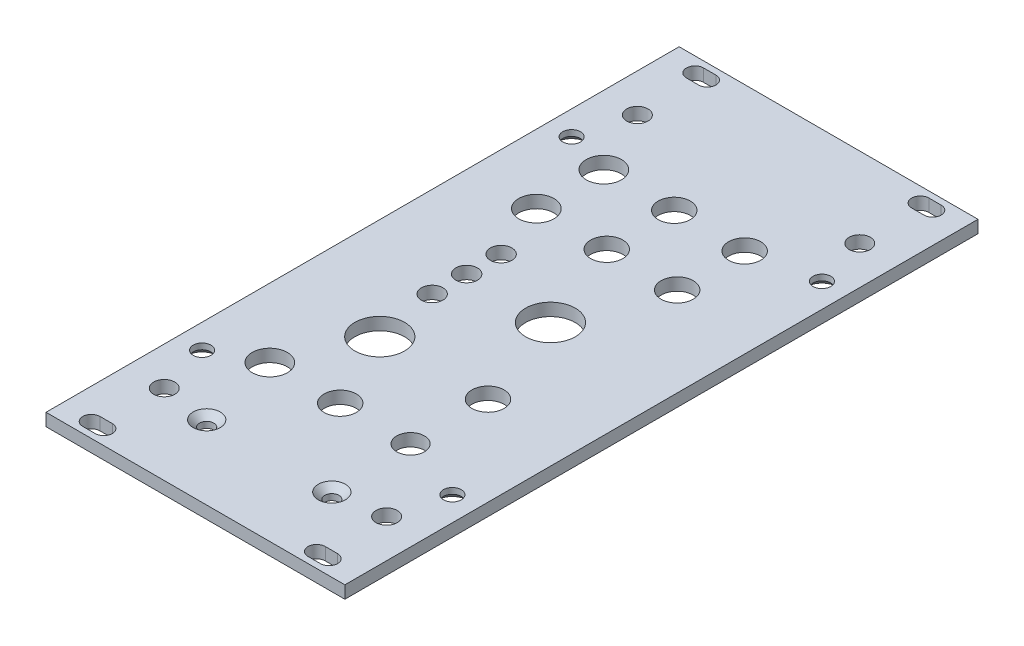
from build123d import *

# Parameters (mm, degrees)
SKETCH1_W                                      = 60.6552
SKETCH1_H                                      = 128.4986
BOSS_EXTRUDE1_DEPTH                            = 2.54
CSK_FOR_M3_FLAT_HEAD_MACHINE_SCREW1_AT_2_COUNT = 2
CSK_FOR_M3_FLAT_HEAD_MACHINE_SCREW1_AT_2_PITCH = 75.0062
M3_CLEARANCE_SLOT1_DEPTH                       = 2.54
F_1_4_CLEARANCE_HOLE1_D                        = 7.14248
F_1_4_CLEARANCE_HOLE2_D                        = 6.5278
F_3_8_CLEARANCE_HOLE2_D                        = 10.0838
F_10_CLEARANCE_HOLE1_D                         = 5.6134
CSK_FOR_M2_5_FLAT_HEAD_MACHINE_SCREW1_AT_COUNT = 2
CSK_FOR_M2_5_FLAT_HEAD_MACHINE_SCREW1_AT_PITCH = 25.4
F_11_64_0_17188_DIAMETER_HOLE1_D               = 4.365752
F_6_CLEARANCE_HOLE1_D                          = 4.3053


# Read off the part's stored shape, not the designer's step: M3 Clearance Slot1
with BuildPart() as part:
    # Sketch1 → Boss-Extrude1 (new body)
    with BuildSketch(Plane(origin=(0, 0, 0), x_dir=(1, 0, 0), z_dir=(0, 1, 0))):
        Rectangle(SKETCH1_W, SKETCH1_H)
    extrude(amount=BOSS_EXTRUDE1_DEPTH)

    # Sketch5 → CSK for M3 Flat Head Machine Screw1 (revolve, cut)
    with BuildSketch(Plane(origin=(25.4, 0, -37.5031), x_dir=(0, 0, -1), z_dir=(1, 0, 0))):
        Polygon((0, 0), (0, 2.54), (1.8, 2.54), (1.8, 1.35), (3.15, 0), align=None)
    csk_for_m3_flat_head_machine_screw1 = revolve(axis=Axis((25.4, -6.35, -37.5031), (0, 1, 0)), mode=Mode.SUBTRACT)

    # CSK for M3 Flat Head Machine Screw1 at 2: CSK for M3 Flat Head Machine Screw1 ×2
    with Locations(*[(0, 0, i * CSK_FOR_M3_FLAT_HEAD_MACHINE_SCREW1_AT_2_PITCH) for i in range(1, CSK_FOR_M3_FLAT_HEAD_MACHINE_SCREW1_AT_2_COUNT)]):
        add(csk_for_m3_flat_head_machine_screw1, mode=Mode.SUBTRACT)

    # M3 Clearance Slot1 outline → M3 Clearance Slot1 (cut)
    with BuildSketch(Plane(origin=(0, 0, 0), x_dir=(1, 0, 0), z_dir=(0, 1, 0))):
        with BuildLine():
            ThreePointArc((24.11, -63.0021), (25.86, -61.2521), (24.11, -59.5021))
            Line((24.11, -59.5021), (21.61, -59.5021))
            ThreePointArc((21.61, -59.5021), (19.86, -61.2521), (21.61, -63.0021))
            Line((21.61, -63.0021), (24.11, -63.0021))
        make_face()
        with BuildLine():
            ThreePointArc((24.11, 59.5021), (25.86, 61.2521), (24.11, 63.0021))
            Line((24.11, 63.0021), (21.61, 63.0021))
            ThreePointArc((21.61, 63.0021), (19.86, 61.2521), (21.61, 59.5021))
            Line((21.61, 59.5021), (24.11, 59.5021))
        make_face()
    m3_clearance_slot1 = extrude(amount=M3_CLEARANCE_SLOT1_DEPTH, mode=Mode.SUBTRACT)

    # Mirror1: CSK for M3 Flat Head Machine Screw1, M3 Clearance Slot1 across plane
    add(csk_for_m3_flat_head_machine_screw1.mirror(Plane(origin=(0, 0, 0), x_dir=(0, 0, 1), z_dir=(1, 0, 0))), mode=Mode.SUBTRACT)
    add(m3_clearance_slot1.mirror(Plane(origin=(0, 0, 0), x_dir=(0, 0, 1), z_dir=(1, 0, 0))), mode=Mode.SUBTRACT)

    # Mirror1 copy 1 sketch → Mirror1 copy 1 (revolve, cut)
    with BuildSketch(Plane(origin=(-25.4, 0, 37.5031), x_dir=(0, 0, -1), z_dir=(-1, 0, 0))):
        Polygon((0, 0), (0, -2.54), (1.8, -2.54), (1.8, -1.35), (3.15, 0), align=None)
    revolve(axis=Axis((-25.4, -6.35, 37.5031), (0, -1, 0)), mode=Mode.SUBTRACT)

    # 1/4 Clearance Hole1 (through all)
    with Locations(Plane(origin=(0, 0, 0), x_dir=(-1, 0, 0), z_dir=(0, -1, 0))):
        with Locations((16.3576, 35.0012), (16.3576, 21.301199968), (16.3576, -32.798800036)):
            Hole(F_1_4_CLEARANCE_HOLE1_D / 2)

    # 1/4 Clearance Hole2 (through all)
    with Locations(Plane(origin=(0, 0, 0), x_dir=(-1, 0, 0), z_dir=(0, -1, 0))):
        with Locations((-12.2174, 35.0012), (2.0701, 35.0012), (2.0701, 21.301199968), (-12.2174, 21.301199968), (-12.2174, -17.08879996), (2.0701, -32.798800036)):
            Hole(F_1_4_CLEARANCE_HOLE2_D / 2)

    # 3/8 Clearance Hole2 (through all)
    with Locations(Plane(origin=(0, 0, 0), x_dir=(-1, 0, 0), z_dir=(0, -1, 0))):
        with Locations((9.7536, -17.08879996), (-5.07365, 2.731200024)):
            Hole(F_3_8_CLEARANCE_HOLE2_D / 2)

    # #10 Clearance Hole1 (through all)
    with Locations(Plane(origin=(0, 0, 0), x_dir=(-1, 0, 0), z_dir=(0, -1, 0))):
        with Locations((-12.2174, -32.798800036)):
            Hole(F_10_CLEARANCE_HOLE1_D / 2)

    # Sketch73 → CSK for M2.5 Flat Head Machine Screw1 (revolve, cut)
    with BuildSketch(Plane(origin=(-12.7, 2.54, 49.2633), x_dir=(0, 0, 1), z_dir=(1, 0, 0))):
        Polygon((0, 0), (0, 2.54), (1.45, 2.54), (1.45, 1.3), (2.75, 0), align=None)
    csk_for_m2_5_flat_head_machine_screw1 = revolve(axis=Axis((-12.7, 8.89, 49.2633), (0, -1, 0)), mode=Mode.SUBTRACT)

    # CSK for M2.5 Flat Head Machine Screw1 at: CSK for M2.5 Flat Head Machine Screw1 ×2
    with Locations(*[(i * CSK_FOR_M2_5_FLAT_HEAD_MACHINE_SCREW1_AT_PITCH, 0, 0) for i in range(1, CSK_FOR_M2_5_FLAT_HEAD_MACHINE_SCREW1_AT_COUNT)]):
        add(csk_for_m2_5_flat_head_machine_screw1, mode=Mode.SUBTRACT)

    # 11/64 (0.17188) Diameter Hole1 (through all)
    with Locations(Plane(origin=(0, 0, 0), x_dir=(-1, 0, 0), z_dir=(0, -1, 0))):
        with Locations((11.938, 9.731199994), (11.938, 2.731200024), (11.938, -4.268799946)):
            Hole(F_11_64_0_17188_DIAMETER_HOLE1_D / 2)

    # #6 Clearance Hole1 (through all)
    with Locations(Plane(origin=(0, 2.54, 0), x_dir=(1, 0, 0), z_dir=(0, 1, 0))):
        with Locations((-22.567944323, 48.012104001), (-22.567944323, -48.012104001)):
            f_6_clearance_hole1 = Hole(F_6_CLEARANCE_HOLE1_D / 2)

    # Mirror2: #6 Clearance Hole1 across plane
    add(f_6_clearance_hole1.mirror(Plane(origin=(0, 0, 0), x_dir=(0, 0, 1), z_dir=(1, 0, 0))), mode=Mode.SUBTRACT)


solid = part.part
